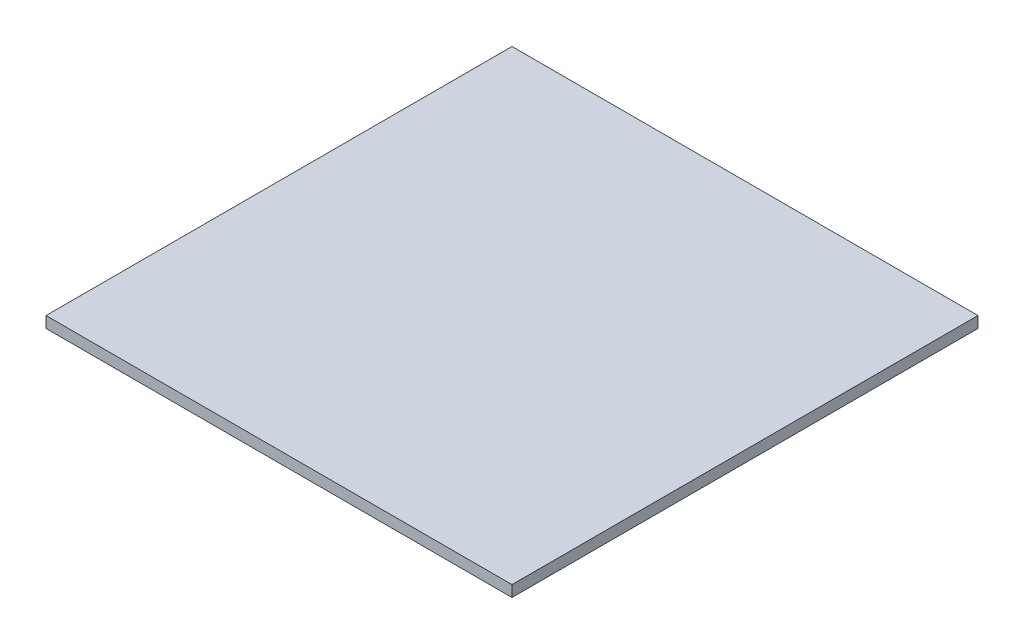
from build123d import *

# Parameters (mm, degrees)
ESBO_O1_W                = 238
ESBO_O1_H                = 250
RESSALTO_EXTRUS_O1_DEPTH = 6
ESBO_O2_W                = 250
ESBO_O2_H                = 6
RESSALTO_EXTRUS_O2_DEPTH = 12


with BuildPart() as part:
    # Esboço1 → Ressalto-extrusão1 (new body)
    with BuildSketch(Plane(origin=(0, 0, 0), x_dir=(1, 0, 0), z_dir=(0, 1, 0))):
        with Locations((119, 125)):
            Rectangle(ESBO_O1_W, ESBO_O1_H)
    extrude(amount=RESSALTO_EXTRUS_O1_DEPTH)

    # Esboço2 → Ressalto-extrusão2 (add)
    with BuildSketch(Plane.ZY):
        with Locations((-125, 3)):
            Rectangle(ESBO_O2_W, ESBO_O2_H)
    extrude(amount=RESSALTO_EXTRUS_O2_DEPTH)


solid = part.part
